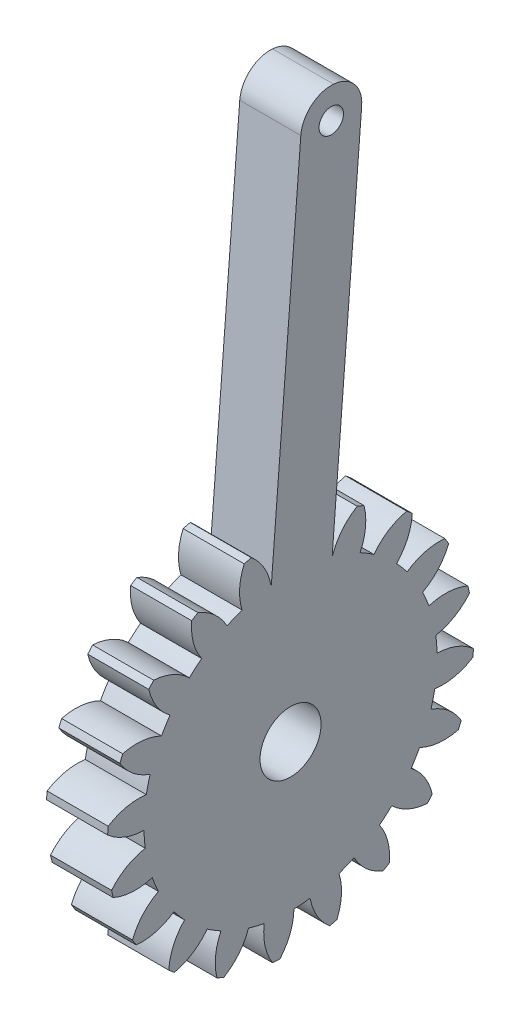
from build123d import *

# Parameters (mm, degrees)
EXTRUDE_1_DEPTH     = 10
EXTRUDE_2_DEPTH     = 10
FILLET_1_R          = 5
SKETCH_3_R          = 5
CUT_EXTRUDE_1_DEPTH = 10
SKETCH_4_R          = 2
CUT_EXTRUDE_2_DEPTH = 10


with BuildPart() as part:
    # 草图1 → 凸台-拉伸1 (new body)
    with BuildSketch(Plane(origin=(0, 0, 0), x_dir=(0, 0, -1), z_dir=(1, 0, 0))):
        with BuildLine():
            ThreePointArc((-7.942884534, 22.647529341), (-9.184402377, 22.17310878), (-10.397754058, 21.630689091))
            ThreePointArc((-10.397754058, 21.630689091), (-12.397305949, 24.184674774), (-15.156649968, 25.889688329))
            ThreePointArc((-15.156649968, 25.889688329), (-15.674956941, 25.579204931), (-16.186906117, 25.258346549))
            ThreePointArc((-16.186906117, 25.258346549), (-15.920443886, 22.02569307), (-14.552603542, 19.084594053))
            ThreePointArc((-14.552603542, 19.084594053), (-15.58675316, 18.249743174), (-16.573102281, 17.358925105))
            ThreePointArc((-16.573102281, 17.358925105), (-19.264014116, 19.170014316), (-22.41518439, 19.938894372))
            ThreePointArc((-22.41518439, 19.938894372), (-22.812178968, 19.48344145), (-23.199920874, 19.020085999))
            ThreePointArc((-23.199920874, 19.020085999), (-21.947555371, 16.027991201), (-19.737812321, 13.653525728))
            ThreePointArc((-19.737812321, 13.653525728), (-20.463363944, 12.539965553), (-21.126159781, 11.387948582))
            ThreePointArc((-21.126159781, 11.387948582), (-24.245026361, 12.278859291), (-27.479564388, 12.036342512))
            ThreePointArc((-27.479564388, 12.036342512), (-27.716385975, 11.480502971), (-27.941965733, 10.920006912))
            ThreePointArc((-27.941965733, 10.920006912), (-25.82628722, 8.46135788), (-22.990946508, 6.885955175))
            ThreePointArc((-22.990946508, 6.885955175), (-23.33687809, 5.602688733), (-23.611241567, 4.302240308))
            ThreePointArc((-23.611241567, 4.302240308), (-26.852766501, 4.185763967), (-29.854053162, 2.955589584))
            ThreePointArc((-29.854053162, 2.955589584), (-29.907520012, 2.353772872), (-29.948856303, 1.751001464))
            ThreePointArc((-29.948856303, 1.751001464), (-27.176962132, 0.066467896), (-23.993566664, -0.555660648))
            ThreePointArc((-23.993566664, -0.555660648), (-23.92601601, -1.883018297), (-23.785090519, -3.204601222))
            ThreePointArc((-23.785090519, -3.204601222), (-26.831970761, -4.317063099), (-29.306219208, -6.414477044))
            ThreePointArc((-29.306219208, -6.414477044), (-29.171097612, -7.003360916), (-29.024144152, -7.589404208))
            ThreePointArc((-29.024144152, -7.589404208), (-25.867366639, -8.334928429), (-22.647529341, -7.942884534))
            ThreePointArc((-22.647529341, -7.942884534), (-22.17310878, -9.184402377), (-21.630689091, -10.397754058))
            ThreePointArc((-21.630689091, -10.397754058), (-24.184674774, -12.397305949), (-25.889688329, -15.156649968))
            ThreePointArc((-25.889688329, -15.156649968), (-25.579204931, -15.674956941), (-25.258346549, -16.186906117))
            ThreePointArc((-25.258346549, -16.186906117), (-22.02569307, -15.920443886), (-19.084594053, -14.552603542))
            ThreePointArc((-19.084594053, -14.552603542), (-18.249743174, -15.58675316), (-17.358925105, -16.573102281))
            ThreePointArc((-17.358925105, -16.573102281), (-19.170014316, -19.264014116), (-19.938894372, -22.41518439))
            ThreePointArc((-19.938894372, -22.41518439), (-19.48344145, -22.812178968), (-19.020085999, -23.199920874))
            ThreePointArc((-19.020085999, -23.199920874), (-16.027991201, -21.947555371), (-13.653525728, -19.737812321))
            ThreePointArc((-13.653525728, -19.737812321), (-12.539965553, -20.463363944), (-11.387948582, -21.126159781))
            ThreePointArc((-11.387948582, -21.126159781), (-12.278859291, -24.245026361), (-12.036342512, -27.479564388))
            ThreePointArc((-12.036342512, -27.479564388), (-11.480502971, -27.716385975), (-10.920006912, -27.941965733))
            ThreePointArc((-10.920006912, -27.941965733), (-8.46135788, -25.82628722), (-6.885955175, -22.990946508))
            ThreePointArc((-6.885955175, -22.990946508), (-5.602688733, -23.33687809), (-4.302240308, -23.611241567))
            ThreePointArc((-4.302240308, -23.611241567), (-4.185763967, -26.852766501), (-2.955589584, -29.854053162))
            ThreePointArc((-2.955589584, -29.854053162), (-2.353772872, -29.907520012), (-1.751001464, -29.948856303))
            ThreePointArc((-1.751001464, -29.948856303), (-0.066467896, -27.176962132), (0.555660648, -23.993566664))
            ThreePointArc((0.555660648, -23.993566664), (1.883018297, -23.92601601), (3.204601222, -23.785090519))
            ThreePointArc((3.204601222, -23.785090519), (4.317063099, -26.831970761), (6.414477044, -29.306219208))
            ThreePointArc((6.414477044, -29.306219208), (7.003360916, -29.171097612), (7.589404208, -29.024144152))
            ThreePointArc((7.589404208, -29.024144152), (8.334928429, -25.867366639), (7.942884534, -22.647529341))
            ThreePointArc((7.942884534, -22.647529341), (9.184402377, -22.17310878), (10.397754058, -21.630689091))
            ThreePointArc((10.397754058, -21.630689091), (12.397305949, -24.184674774), (15.156649968, -25.889688329))
            ThreePointArc((15.156649968, -25.889688329), (15.674956941, -25.579204931), (16.186906117, -25.258346549))
            ThreePointArc((16.186906117, -25.258346549), (15.920443886, -22.02569307), (14.552603542, -19.084594053))
            ThreePointArc((14.552603542, -19.084594053), (15.58675316, -18.249743174), (16.573102281, -17.358925105))
            ThreePointArc((16.573102281, -17.358925105), (19.264014116, -19.170014316), (22.41518439, -19.938894372))
            ThreePointArc((22.41518439, -19.938894372), (22.812178968, -19.48344145), (23.199920874, -19.020085999))
            ThreePointArc((23.199920874, -19.020085999), (21.947555371, -16.027991201), (19.737812321, -13.653525728))
            ThreePointArc((19.737812321, -13.653525728), (20.463363944, -12.539965553), (21.126159781, -11.387948582))
            ThreePointArc((21.126159781, -11.387948582), (24.245026361, -12.278859291), (27.479564388, -12.036342512))
            ThreePointArc((27.479564388, -12.036342512), (27.716385975, -11.480502971), (27.941965733, -10.920006912))
            ThreePointArc((27.941965733, -10.920006912), (25.82628722, -8.46135788), (22.990946508, -6.885955175))
            ThreePointArc((22.990946508, -6.885955175), (23.33687809, -5.602688733), (23.611241567, -4.302240308))
            ThreePointArc((23.611241567, -4.302240308), (26.852766501, -4.185763967), (29.854053162, -2.955589584))
            ThreePointArc((29.854053162, -2.955589584), (29.907520012, -2.353772872), (29.948856303, -1.751001464))
            ThreePointArc((29.948856303, -1.751001464), (27.176962132, -0.066467896), (23.993566664, 0.555660648))
            ThreePointArc((23.993566664, 0.555660648), (23.92601601, 1.883018297), (23.785090519, 3.204601222))
            ThreePointArc((23.785090519, 3.204601222), (26.831970761, 4.317063099), (29.306219208, 6.414477044))
            ThreePointArc((29.306219208, 6.414477044), (29.171097612, 7.003360916), (29.024144152, 7.589404208))
            ThreePointArc((29.024144152, 7.589404208), (25.867366639, 8.334928429), (22.647529341, 7.942884534))
            ThreePointArc((22.647529341, 7.942884534), (22.17310878, 9.184402377), (21.630689091, 10.397754058))
            ThreePointArc((21.630689091, 10.397754058), (24.184674774, 12.397305949), (25.889688329, 15.156649968))
            ThreePointArc((25.889688329, 15.156649968), (25.579204931, 15.674956941), (25.258346549, 16.186906117))
            ThreePointArc((25.258346549, 16.186906117), (22.02569307, 15.920443886), (19.084594053, 14.552603542))
            ThreePointArc((19.084594053, 14.552603542), (18.249743174, 15.58675316), (17.358925105, 16.573102281))
            ThreePointArc((17.358925105, 16.573102281), (19.170014316, 19.264014116), (19.938894372, 22.41518439))
            ThreePointArc((19.938894372, 22.41518439), (19.48344145, 22.812178968), (19.020085999, 23.199920874))
            ThreePointArc((19.020085999, 23.199920874), (16.027991201, 21.947555371), (13.653525728, 19.737812321))
            ThreePointArc((13.653525728, 19.737812321), (12.539965553, 20.463363944), (11.387948582, 21.126159781))
            ThreePointArc((11.387948582, 21.126159781), (12.278859291, 24.245026361), (12.036342512, 27.479564388))
            ThreePointArc((12.036342512, 27.479564388), (11.480502971, 27.716385975), (10.920006912, 27.941965733))
            ThreePointArc((10.920006912, 27.941965733), (8.46135788, 25.82628722), (6.885955175, 22.990946508))
            ThreePointArc((6.885955175, 22.990946508), (5.602688733, 23.33687809), (4.302240308, 23.611241567))
            ThreePointArc((4.302240308, 23.611241567), (4.185763967, 26.852766501), (2.955589584, 29.854053162))
            ThreePointArc((2.955589584, 29.854053162), (2.353772872, 29.907520012), (1.751001464, 29.948856303))
            ThreePointArc((1.751001464, 29.948856303), (0.066467896, 27.176962132), (-0.555660648, 23.993566664))
            ThreePointArc((-0.555660648, 23.993566664), (-1.883018297, 23.92601601), (-3.204601222, 23.785090519))
            ThreePointArc((-3.204601222, 23.785090519), (-4.317063099, 26.831970761), (-6.414477044, 29.306219208))
            ThreePointArc((-6.414477044, 29.306219208), (-7.003360916, 29.171097612), (-7.589404208, 29.024144152))
            ThreePointArc((-7.589404208, 29.024144152), (-8.334928429, 25.867366639), (-7.942884534, 22.647529341))
        make_face()
    extrude(amount=EXTRUDE_1_DEPTH)

    # 草图2 → 凸台-拉伸2 (add)
    with BuildSketch(Plane(origin=(10, 0, 0), x_dir=(0, 0, -1), z_dir=(1, 0, 0))):
        Polygon((2.076731947, 90.114855515), (-4.984586669, 0.392295479), (4.984586669, -0.392295479), (12.045905284, 89.330264557), align=None)
    extrude(amount=-EXTRUDE_2_DEPTH)

    # 圆角1
    fillet_1_edges = [part.edges().sort_by_distance(p)[0] for p in [
        (5, 89.330264557, -12.045905284),
        (5, 90.114855515, -2.076731947),
    ]]
    fillet(fillet_1_edges, radius=FILLET_1_R - 0.0001)  # a hair under: the kernel refuses the full size

    # 草图3 → 切除-拉伸1 (cut)
    with BuildSketch(Plane(origin=(10, 0, 0), x_dir=(0, 0, -1), z_dir=(1, 0, 0))):
        Circle(SKETCH_3_R)
    extrude(amount=-CUT_EXTRUDE_1_DEPTH, mode=Mode.SUBTRACT)

    # 草图4 → 切除-拉伸2 (cut)
    with BuildSketch(Plane(origin=(10, 0, 0), x_dir=(0, 0, -1), z_dir=(1, 0, 0))):
        with Locations((6.669023137, 84.737973367)):
            Circle(SKETCH_4_R)
    extrude(amount=-CUT_EXTRUDE_2_DEPTH, mode=Mode.SUBTRACT)


solid = part.part
